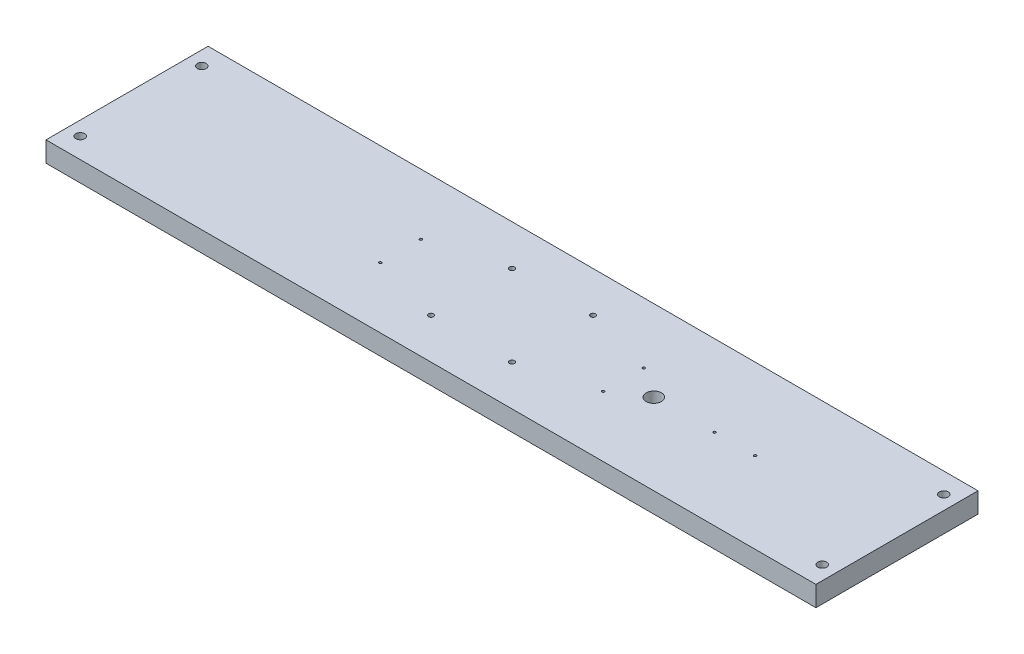
from build123d import *

# Parameters (mm, degrees)
SKETCH1_W           = 482.6
SKETCH1_H           = 101.6
BOSS_EXTRUDE1_DEPTH = 12.7
SKETCH2_R           = 2.7813
CUT_EXTRUDE1_DEPTH  = 247.916220609
SKETCH3_R           = 1.5875
CUT_EXTRUDE2_DEPTH  = 247.916220609
SKETCH4_R           = 0.79375
CUT_EXTRUDE3_DEPTH  = 247.916220609
SKETCH5_R           = 0.79375
CUT_EXTRUDE4_DEPTH  = 247.916220609
SKETCH6_R           = 4.7625
CUT_EXTRUDE5_DEPTH  = 247.916220609


with BuildPart() as part:
    # Sketch1 → Boss-Extrude1 (new body)
    with BuildSketch(Plane(origin=(0, 0, 0), x_dir=(1, 0, 0), z_dir=(0, 1, 0))):
        Rectangle(SKETCH1_W, SKETCH1_H)
    extrude(amount=BOSS_EXTRUDE1_DEPTH)

    # Sketch2 → Cut-Extrude1 (cut, through all)
    with BuildSketch(Plane(origin=(0, 12.7, 0), x_dir=(1, 0, 0), z_dir=(0, 1, 0))):
        with Locations((-232.5624, 38.1)):
            Circle(SKETCH2_R)
        with Locations((-232.5624, -38.1)):
            Circle(SKETCH2_R)
        with Locations((232.5624, 38.1)):
            Circle(SKETCH2_R)
        with Locations((232.5624, -38.1)):
            Circle(SKETCH2_R)
    extrude(amount=-CUT_EXTRUDE1_DEPTH, mode=Mode.SUBTRACT)

    # Sketch3 → Cut-Extrude2 (cut, through all)
    with BuildSketch(Plane(origin=(0, 12.7, 0), x_dir=(1, 0, 0), z_dir=(0, 1, 0))):
        with Locations((-25.4, 25.4)):
            Circle(SKETCH3_R)
        with Locations((25.4, 25.4)):
            Circle(SKETCH3_R)
        with Locations((25.4, -25.4)):
            Circle(SKETCH3_R)
        with Locations((-25.4, -25.4)):
            Circle(SKETCH3_R)
    extrude(amount=-CUT_EXTRUDE2_DEPTH, mode=Mode.SUBTRACT)

    # Sketch4 → Cut-Extrude3 (cut, through all)
    with BuildSketch(Plane(origin=(0, 12.7, 0), x_dir=(1, 0, 0), z_dir=(0, 1, 0))):
        with Locations((-69.85, 12.7)):
            Circle(SKETCH4_R)
        with Locations((-69.85, -12.7)):
            Circle(SKETCH4_R)
        with Locations((69.85, -12.7)):
            Circle(SKETCH4_R)
        with Locations((69.85, 12.7)):
            Circle(SKETCH4_R)
    extrude(amount=-CUT_EXTRUDE3_DEPTH, mode=Mode.SUBTRACT)

    # Sketch5 → Cut-Extrude4 (cut, through all)
    with BuildSketch(Plane(origin=(0, 12.7, 0), x_dir=(1, 0, 0), z_dir=(0, 1, 0))):
        with Locations((127, 0)):
            Circle(SKETCH5_R)
        with Locations((152.4, 0)):
            Circle(SKETCH5_R)
    extrude(amount=-CUT_EXTRUDE4_DEPTH, mode=Mode.SUBTRACT)

    # Sketch6 → Cut-Extrude5 (cut, through all)
    with BuildSketch(Plane(origin=(0, 12.7, 0), x_dir=(1, 0, 0), z_dir=(0, 1, 0))):
        with Locations((88.9, 0)):
            Circle(SKETCH6_R)
    extrude(amount=-CUT_EXTRUDE5_DEPTH, mode=Mode.SUBTRACT)


solid = part.part
